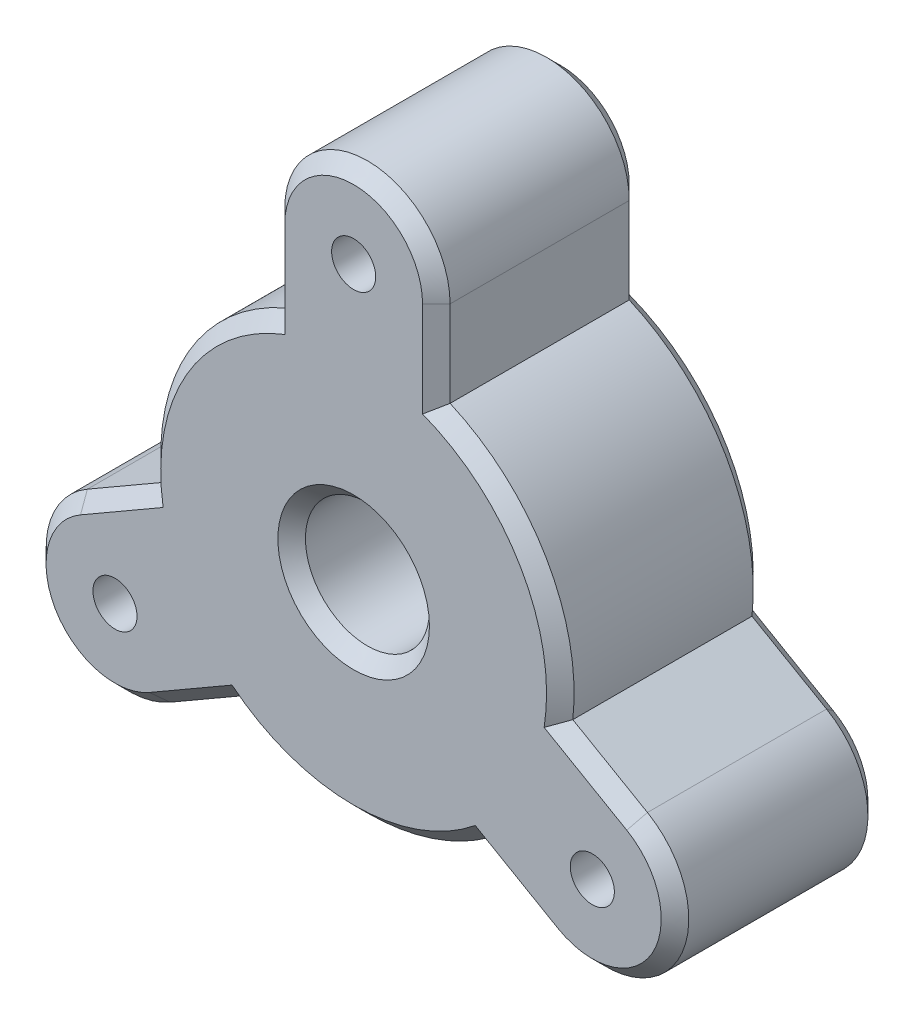
from build123d import *

# Parameters (mm, degrees)
SKETCH1_R                       = 15
BOSS_EXTRUDE1_DEPTH             = 7.5
BOSS_EXTRUDE2_REACH             = 24.5
BOSS_EXTRUDE2_DIRECTION_2_REACH = 24.5
CUT_EXTRUDE1_DEPTH              = 36.722487272
CUT_EXTRUDE1_DEPTH_BACK         = 36.722487272
SKETCH3_R                       = 4.5
CHAMFER1_SIZE                   = 1
CUT_EXTRUDE2_DEPTH              = 36.722487272
CUT_EXTRUDE2_DEPTH_BACK         = 36.722487272
SKETCH4_R                       = 1.6


with BuildPart() as part:
    # Sketch1 → Boss-Extrude1 (new, symmetric)
    with BuildSketch(Plane.XY):
        Circle(SKETCH1_R)
    extrude(amount=BOSS_EXTRUDE1_DEPTH, both=True)

    # Boss-Extrude2: up to this face of the body (flat: up to its plane)
    boss_extrude2_end = Plane(part.part.faces().sort_by_distance((0, 0, 7.5))[0])
    # Sketch2 → Boss-Extrude2 (add, up to the picked face)
    with BuildSketch(Plane.XY, mode=Mode.PRIVATE) as boss_extrude2_sk1:
        with BuildLine():
            Line((-6, 20), (-6, 13.747727085))
            Line((-6, 13.747727085), (6, 13.747727085))
            Line((6, 13.747727085), (6, 20))
            ThreePointArc((6, 20), (0, 26), (-6, 20))
        make_face()
    boss_extrude2_tool1 = split(extrude(boss_extrude2_sk1.sketch, amount=BOSS_EXTRUDE2_REACH, mode=Mode.PRIVATE), bisect_by=boss_extrude2_end, keep=Keep.BOTH, mode=Mode.PRIVATE)
    # Sketch2 → Boss-Extrude2 (add, up to the picked face)
    with BuildSketch(Plane.XY, mode=Mode.PRIVATE) as boss_extrude2_sk2:
        with BuildLine():
            Line((20.320508076, -4.803847577), (14.9058809, -1.67771112))
            Line((14.9058809, -1.67771112), (8.9058809, -12.070015965))
            Line((8.9058809, -12.070015965), (14.320508076, -15.196152423))
            ThreePointArc((14.320508076, -15.196152423), (22.516660498, -13), (20.320508076, -4.803847577))
        make_face()
    boss_extrude2_tool2 = split(extrude(boss_extrude2_sk2.sketch, amount=BOSS_EXTRUDE2_REACH, mode=Mode.PRIVATE), bisect_by=boss_extrude2_end, keep=Keep.BOTH, mode=Mode.PRIVATE)
    # Sketch2 → Boss-Extrude2 (add, up to the picked face)
    with BuildSketch(Plane.XY, mode=Mode.PRIVATE) as boss_extrude2_sk3:
        with BuildLine():
            Line((-14.320508076, -15.196152423), (-8.9058809, -12.070015965))
            Line((-8.9058809, -12.070015965), (-14.9058809, -1.67771112))
            Line((-14.9058809, -1.67771112), (-20.320508076, -4.803847577))
            ThreePointArc((-20.320508076, -4.803847577), (-22.516660498, -13), (-14.320508076, -15.196152423))
        make_face()
    boss_extrude2_tool3 = split(extrude(boss_extrude2_sk3.sketch, amount=BOSS_EXTRUDE2_REACH, mode=Mode.PRIVATE), bisect_by=boss_extrude2_end, keep=Keep.BOTH, mode=Mode.PRIVATE)
    add(boss_extrude2_tool1.solids().sort_by(Axis((0, 19.311838, 0), (0, 0, 1)))[0])
    add(boss_extrude2_tool2.solids().sort_by(Axis((16.724543, -9.655919, 0), (0, 0, 1)))[0])
    add(boss_extrude2_tool3.solids().sort_by(Axis((-16.724543, -9.655919, 0), (0, 0, 1)))[0])

    # Boss-Extrude2 direction 2: up to this face of the body (flat: up to its plane)
    boss_extrude2_direction_2_end = Plane(part.part.faces().sort_by_distance((0, 0, -7.5))[0])
    # Sketch2 → Boss-Extrude2 direction 2 (add, up to the picked face)
    with BuildSketch(Plane.XY, mode=Mode.PRIVATE) as boss_extrude2_direction_2_sk1:
        with BuildLine():
            Line((-6, 20), (-6, 13.747727085))
            Line((-6, 13.747727085), (6, 13.747727085))
            Line((6, 13.747727085), (6, 20))
            ThreePointArc((6, 20), (0, 26), (-6, 20))
        make_face()
    boss_extrude2_direction_2_tool1 = split(extrude(boss_extrude2_direction_2_sk1.sketch, amount=-BOSS_EXTRUDE2_DIRECTION_2_REACH, mode=Mode.PRIVATE), bisect_by=boss_extrude2_direction_2_end, keep=Keep.BOTH, mode=Mode.PRIVATE)
    # Sketch2 → Boss-Extrude2 direction 2 (add, up to the picked face)
    with BuildSketch(Plane.XY, mode=Mode.PRIVATE) as boss_extrude2_direction_2_sk2:
        with BuildLine():
            Line((20.320508076, -4.803847577), (14.9058809, -1.67771112))
            Line((14.9058809, -1.67771112), (8.9058809, -12.070015965))
            Line((8.9058809, -12.070015965), (14.320508076, -15.196152423))
            ThreePointArc((14.320508076, -15.196152423), (22.516660498, -13), (20.320508076, -4.803847577))
        make_face()
    boss_extrude2_direction_2_tool2 = split(extrude(boss_extrude2_direction_2_sk2.sketch, amount=-BOSS_EXTRUDE2_DIRECTION_2_REACH, mode=Mode.PRIVATE), bisect_by=boss_extrude2_direction_2_end, keep=Keep.BOTH, mode=Mode.PRIVATE)
    # Sketch2 → Boss-Extrude2 direction 2 (add, up to the picked face)
    with BuildSketch(Plane.XY, mode=Mode.PRIVATE) as boss_extrude2_direction_2_sk3:
        with BuildLine():
            Line((-14.320508076, -15.196152423), (-8.9058809, -12.070015965))
            Line((-8.9058809, -12.070015965), (-14.9058809, -1.67771112))
            Line((-14.9058809, -1.67771112), (-20.320508076, -4.803847577))
            ThreePointArc((-20.320508076, -4.803847577), (-22.516660498, -13), (-14.320508076, -15.196152423))
        make_face()
    boss_extrude2_direction_2_tool3 = split(extrude(boss_extrude2_direction_2_sk3.sketch, amount=-BOSS_EXTRUDE2_DIRECTION_2_REACH, mode=Mode.PRIVATE), bisect_by=boss_extrude2_direction_2_end, keep=Keep.BOTH, mode=Mode.PRIVATE)
    add(boss_extrude2_direction_2_tool1.solids().sort_by(Axis((0, 19.311838, 0), (0, 0, -1)))[0])
    add(boss_extrude2_direction_2_tool2.solids().sort_by(Axis((16.724543, -9.655919, 0), (0, 0, -1)))[0])
    add(boss_extrude2_direction_2_tool3.solids().sort_by(Axis((-16.724543, -9.655919, 0), (0, 0, -1)))[0])

    # Sketch3 → Cut-Extrude1 (cut, two sides: drawn at the far end of the back side and taken through both)
    with BuildSketch(Plane.XY.offset(-CUT_EXTRUDE1_DEPTH_BACK)):
        Circle(SKETCH3_R)
    extrude(amount=CUT_EXTRUDE1_DEPTH + CUT_EXTRUDE1_DEPTH_BACK, mode=Mode.SUBTRACT)

    # Chamfer1
    chamfer1_edges = [part.edges().sort_by_distance(p)[0] for p in [
        (-4.5, 0, 7.5),
        (-6, 16.873863542, 7.5),
        (0, 26, 7.5),
        (6, 16.873863542, 7.5),
        (12.990381057, 7.5, 7.5),
        (17.613194488, -3.240779349, 7.5),
        (22.516660498, -13, 7.5),
        (11.613194488, -13.633084194, 7.5),
        (0, -15, 7.5),
        (-11.613194488, -13.633084194, 7.5),
        (-22.516660498, -13, 7.5),
        (-17.613194488, -3.240779349, 7.5),
        (-12.990381057, 7.5, 7.5),
        (-4.5, 0, -7.5),
        (11.613194488, -13.633084194, -7.5),
        (22.516660498, -13, -7.5),
        (17.613194488, -3.240779349, -7.5),
        (12.990381057, 7.5, -7.5),
        (6, 16.873863542, -7.5),
        (0, 26, -7.5),
        (-6, 16.873863542, -7.5),
        (-12.990381057, 7.5, -7.5),
        (-17.613194488, -3.240779349, -7.5),
        (-22.516660498, -13, -7.5),
        (-11.613194488, -13.633084194, -7.5),
        (0, -15, -7.5),
    ]]
    chamfer(chamfer1_edges, length=CHAMFER1_SIZE)

    # Sketch4 → Cut-Extrude2 (cut, two sides: drawn at the far end of the back side and taken through both)
    with BuildSketch(Plane.XY.offset(-CUT_EXTRUDE2_DEPTH_BACK)):
        with Locations((0, 20)):
            Circle(SKETCH4_R)
        with Locations((17.320508076, -10)):
            Circle(SKETCH4_R)
        with Locations((-17.320508076, -10)):
            Circle(SKETCH4_R)
    extrude(amount=CUT_EXTRUDE2_DEPTH + CUT_EXTRUDE2_DEPTH_BACK, mode=Mode.SUBTRACT)


solid = part.part
